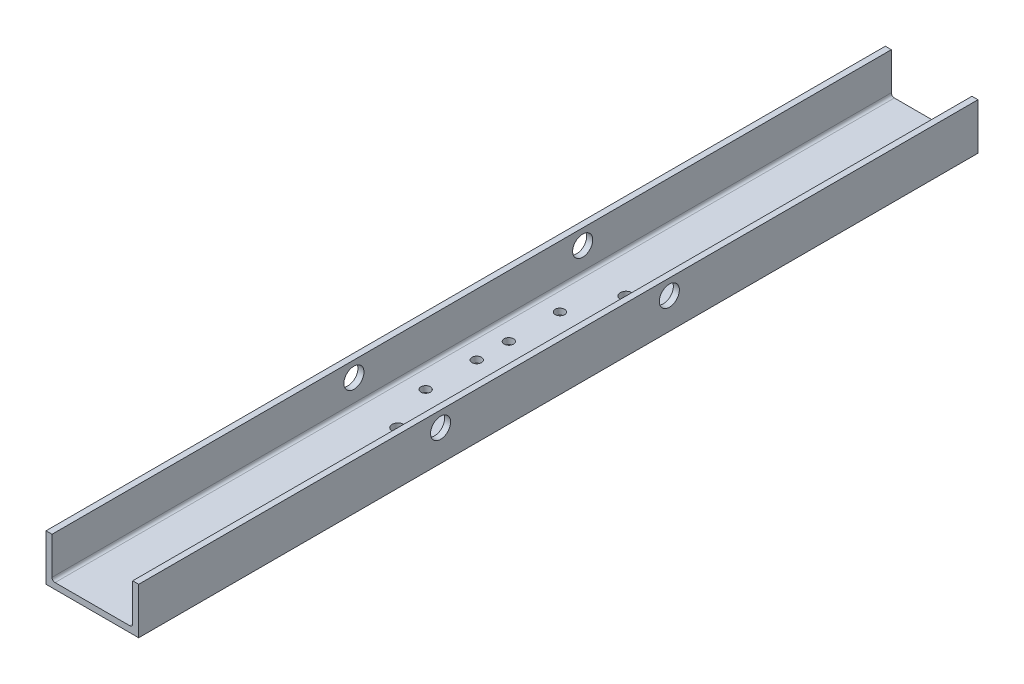
from build123d import *

# Parameters (mm, degrees)
BOSS_EXTRUDE1_DEPTH = 230
FILLET1_R           = 1.651
SKETCH4_R           = 2.585
CUT_EXTRUDE1_DEPTH  = 10
SKETCH5_R           = 3.18
CUT_EXTRUDE2_DEPTH  = 233.451030551
SKETCH6_R           = 5.5
CUT_EXTRUDE3_DEPTH  = 236.196407294
SKETCH7_R           = 5.5
CUT_EXTRUDE4_DEPTH  = 236.885417099


with BuildPart() as part:
    # Sketch3 → Boss-Extrude1 (new, symmetric)
    with BuildSketch(Plane.XY):
        Polygon((-25.4, 12.7), (-25.4, -12.7), (25.4, -12.7), (25.4, 12.7), (22.098, 12.7), (22.098, -9.398), (-22.098, -9.398), (-22.098, 12.7), align=None)
    extrude(amount=BOSS_EXTRUDE1_DEPTH, both=True)

    # Fillet1
    fillet1_edges = [part.edges().sort_by_distance(p)[0] for p in [
        (22.098, -9.398, 0),
        (-22.098, -9.398, 0),
    ]]
    fillet(fillet1_edges, radius=FILLET1_R)

    # Sketch4 → Cut-Extrude1 (cut)
    with BuildSketch(Plane(origin=(0, -9.398, 0), x_dir=(1, 0, 0), z_dir=(0, 1, 0))):
        with Locations((-10.530435142, 8.79)):
            Circle(SKETCH4_R)
        with Locations((10.469564858, 8.79)):
            Circle(SKETCH4_R)
        with Locations((-10.530435142, 36.79)):
            Circle(SKETCH4_R)
        with Locations((10.469564858, 36.79)):
            Circle(SKETCH4_R)
        with Locations((-10.530435142, -36.79)):
            Circle(SKETCH4_R)
        with Locations((10.469564858, -36.79)):
            Circle(SKETCH4_R)
        with Locations((10.469564858, -8.79)):
            Circle(SKETCH4_R)
        with Locations((-10.530435142, -8.79)):
            Circle(SKETCH4_R)
    extrude(amount=-CUT_EXTRUDE1_DEPTH, mode=Mode.SUBTRACT)

    # Sketch5 → Cut-Extrude2 (cut, through all)
    with BuildSketch(Plane(origin=(0, -9.398, 0), x_dir=(1, 0, 0), z_dir=(0, 1, 0))):
        with Locations((0, 62.521391607)):
            Circle(SKETCH5_R)
        with Locations((0, -62.52)):
            Circle(SKETCH5_R)
    extrude(amount=-CUT_EXTRUDE2_DEPTH, mode=Mode.SUBTRACT)

    # Sketch6 → Cut-Extrude3 (cut, through all)
    with BuildSketch(Plane.ZY.offset(-22.098)):
        with Locations((64.543631174, 4.26500546)):
            Circle(SKETCH6_R)
        with Locations((-60.827499788, 4.264871568)):
            Circle(SKETCH6_R)
    extrude(amount=-CUT_EXTRUDE3_DEPTH, mode=Mode.SUBTRACT)

    # Sketch7 → Cut-Extrude4 (cut, through all)
    with BuildSketch(Plane.ZY.offset(25.4)):
        with Locations((64.543631174, 4.26500546)):
            Circle(SKETCH7_R)
        with Locations((-60.827499788, 4.264871568)):
            Circle(SKETCH7_R)
    extrude(amount=-CUT_EXTRUDE4_DEPTH, mode=Mode.SUBTRACT)


solid = part.part
